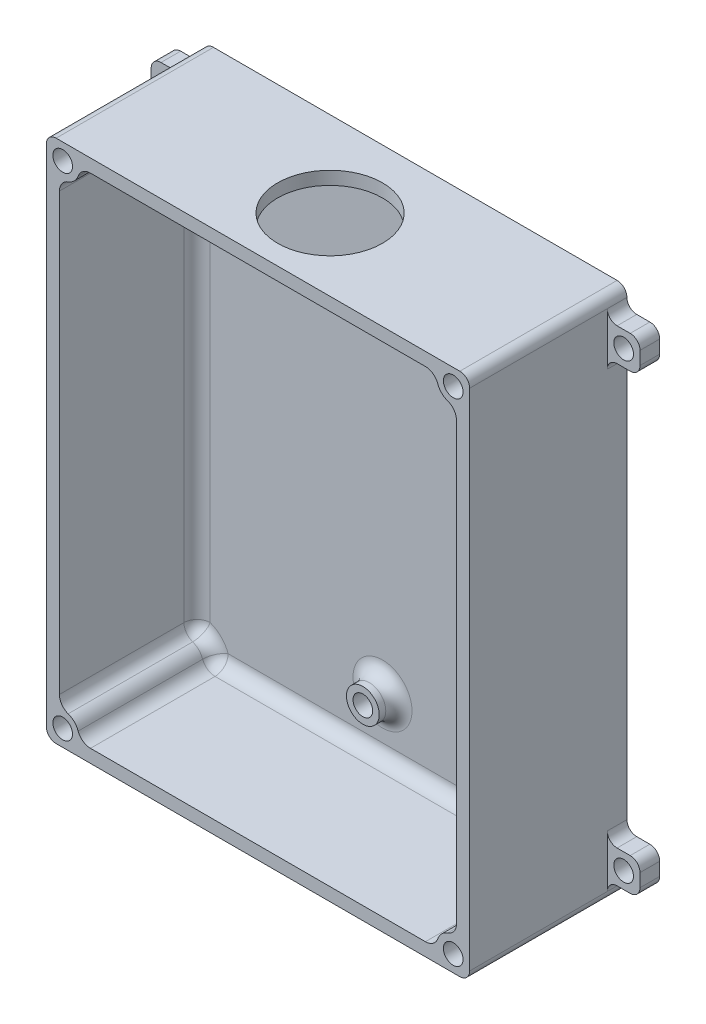
from build123d import *

# Parameters (mm, degrees)
SKETCH1_R          = 2.499999999999999
SKETCH1_W          = 60.58456356151953
SKETCH1_H          = 76
SKETCH1_R_2        = 1.5000000000000024
SKETCH1_R_3        = 1.5000000000000042
SKETCH1_R_4        = 2.500000000000004
BASE_DEPTH         = 3
WALLS_START        = 3
WALLS_DEPTH        = 21
STANDOFFS_START    = 3
SKETCH1_5_R        = 2.500000000000004
SKETCH1_5_R_2      = 1.5000000000000024
STANDOFFS_DEPTH    = 3
EXTERNAL_FILLET_R  = 1.5
INTERNAL_FILLET_R  = 2
SKETCH3_R          = 8.000000000000002
CUT_EXTRUDE1_DEPTH = 2


with BuildPart() as part:
    # Sketch1 → BASE (new body)
    # profile 1 of 53: a face of its own
    with BuildSketch(Plane.XY):
        with BuildLine():
            Line((-32.292281780759765, 39.999999999999986), (-32.292281780759765, 37.499999965069506))
            ThreePointArc((-32.292281780759765, 37.499999965069506), (-31.560048746075857, 39.267766940616646), (-29.79228178075956, 39.99999999999999))
            Line((-29.79228178075956, 39.99999999999999), (-32.292281780759765, 39.99999999999999))
        make_face()
    # profile 2 of 53: a face of its own
    with BuildSketch(Plane.XY):
        with BuildLine():
            ThreePointArc((-32.292281780759765, 37.499999965069506), (-31.728773442817484, 35.91886115638728), (-30.292281780759765, 35.050510257216814))
            Line((-30.292281780759765, 35.050510257216814), (-30.292281780759765, 36.085786437626865))
            ThreePointArc((-30.292281780759716, 36.08578643762688), (-30.85294195253962, 38.56066017177979), (-28.37806821838668, 38.000000000000014))
            Line((-28.378068218386687, 37.99999999999999), (-27.342792037976604, 37.99999999999999))
            ThreePointArc((-27.342792037976597, 38.00000000000002), (-28.21114295067551, 39.436491673103646), (-29.79228178075956, 39.99999999999999))
            ThreePointArc((-29.79228178075956, 39.99999999999999), (-31.560048746075857, 39.267766940616646), (-32.292281780759765, 37.499999965069506))
        make_face()
    # profile 3 of 53: a face of its own
    with BuildSketch(Plane.XY):
        with BuildLine():
            Line((-30.292281780759765, 36.085786437626865), (-30.292281780759765, 35.050510257216814))
            ThreePointArc((-30.292281780759765, 35.050510257216814), (-28.21114295067558, 35.56350832689628), (-27.29228178075977, 37.49999999999999))
            ThreePointArc((-27.29228178075977, 37.49999999999999), (-27.30494139824696, 37.751272405013026), (-27.342792037976597, 38.00000000000002))
            Line((-27.342792037976604, 37.99999999999999), (-28.378068218386687, 37.99999999999999))
            ThreePointArc((-28.37806821838668, 38.000000000000014), (-28.31388394127954, 37.75365296808865), (-28.29228178075977, 37.49999999999999))
            ThreePointArc((-28.29228178075977, 37.49999999999999), (-28.926256376975306, 36.27525512860842), (-30.292281780759716, 36.08578643762688))
        make_face()
    # profile 4 of 53: a face of its own
    with BuildSketch(Plane.XY):
        with BuildLine():
            Line((29.79228178075983, 40.00000000000002), (-29.79228178075956, 39.99999999999999))
            ThreePointArc((-29.79228178075956, 39.99999999999999), (-28.21114295067551, 39.436491673103646), (-27.342792037976597, 38.00000000000002))
            Line((-27.342792037976604, 37.99999999999999), (27.342792037976594, 37.99999999999999))
            ThreePointArc((27.342792037976594, 38.000000000000014), (28.211142950675608, 39.43649167310373), (29.79228178075983, 40))
        make_face()
    # profile 5 of 53: a face of its own
    with BuildSketch(Plane.XY):
        with BuildLine():
            Line((-32.292281780759765, -37.00000000000002), (-32.292281780759765, -37.49999999999999))
            ThreePointArc((-32.292281780759765, -37.49999999999999), (-31.728773453863475, -35.9188611699158), (-30.292281780759765, -35.050510257216814))
            Line((-30.292281780759765, -35.050510257216814), (-30.292281780759765, 35.050510257216814))
            ThreePointArc((-30.292281780759765, 35.050510257216814), (-31.728773442817484, 35.91886115638728), (-32.292281780759765, 37.499999965069506))
            Line((-32.292281780759765, 37.499999965069506), (-32.292281780759765, 37.000000000000014))
            Line((-32.292281780759765, 37.000000000000014), (-32.292281780759765, 32.000000000000014))
            Line((-32.292281780759765, 32.000000000000014), (-32.292281780759765, -32.000000000000014))
            Line((-32.292281780759765, -32.000000000000014), (-32.292281780759765, -37.00000000000002))
        make_face()
    # profile 6 of 53: a face of its own
    with BuildSketch(Plane.XY):
        with BuildLine():
            ThreePointArc((-32.292281780759765, 37.499999965069506), (-31.728773442817484, 35.91886115638728), (-30.292281780759765, 35.050510257216814))
            Line((-30.292281780759765, 35.050510257216814), (-30.292281780759765, 36.085786437626865))
            ThreePointArc((-30.292281780759716, 36.08578643762688), (-30.85294195253962, 38.56066017177979), (-28.37806821838668, 38.000000000000014))
            Line((-28.378068218386687, 37.99999999999999), (-27.342792037976604, 37.99999999999999))
            ThreePointArc((-27.342792037976597, 38.00000000000002), (-28.21114295067551, 39.436491673103646), (-29.79228178075956, 39.99999999999999))
            ThreePointArc((-29.79228178075956, 39.99999999999999), (-31.560048746075857, 39.267766940616646), (-32.292281780759765, 37.499999965069506))
        make_face()
    # profile 7 of 53: a face of its own
    with BuildSketch(Plane.XY):
        with BuildLine():
            Line((-30.292281780759765, 36.085786437626865), (-30.292281780759765, 35.050510257216814))
            ThreePointArc((-30.292281780759765, 35.050510257216814), (-28.21114295067558, 35.56350832689628), (-27.29228178075977, 37.49999999999999))
            ThreePointArc((-27.29228178075977, 37.49999999999999), (-27.30494139824696, 37.751272405013026), (-27.342792037976597, 38.00000000000002))
            Line((-27.342792037976604, 37.99999999999999), (-28.378068218386687, 37.99999999999999))
            ThreePointArc((-28.37806821838668, 38.000000000000014), (-28.31388394127954, 37.75365296808865), (-28.29228178075977, 37.49999999999999))
            ThreePointArc((-28.29228178075977, 37.49999999999999), (-28.926256376975306, 36.27525512860842), (-30.292281780759716, 36.08578643762688))
        make_face()
    # profile 8 of 53: a face of its own
    with BuildSketch(Plane.XY):
        with BuildLine():
            ThreePointArc((-32.292281780759765, -37.49999999999999), (-31.560048733726116, -39.26776695296638), (-29.79228178075971, -39.99999999999999))
            ThreePointArc((-29.79228178075971, -39.99999999999999), (-28.211142950675576, -39.436491673103696), (-27.3427920379766, -38.00000000000004))
            Line((-27.342792037976608, -38.000000000000014), (-28.37806821838667, -38.000000000000014))
            ThreePointArc((-28.378068218386662, -38.000000000000036), (-30.85294195253959, -38.56066017177981), (-30.29228178075972, -36.0857864376269))
            Line((-30.292281780759765, -36.085786437626886), (-30.292281780759765, -35.050510257216814))
            ThreePointArc((-30.292281780759765, -35.050510257216814), (-31.728773453863475, -35.9188611699158), (-32.292281780759765, -37.49999999999999))
        make_face()
    # profile 9 of 53: a face of its own
    with BuildSketch(Plane.XY):
        with BuildLine():
            Line((-28.37806821838667, -38.000000000000014), (-27.342792037976608, -38.000000000000014))
            ThreePointArc((-27.3427920379766, -38.00000000000004), (-27.304941398246964, -37.75127240501304), (-27.29228178075977, -37.49999999999999))
            ThreePointArc((-27.29228178075977, -37.49999999999999), (-28.21114295067558, -35.56350832689628), (-30.292281780759765, -35.050510257216814))
            Line((-30.292281780759765, -35.050510257216814), (-30.292281780759765, -36.085786437626886))
            ThreePointArc((-30.29228178075972, -36.0857864376269), (-28.926256376975296, -36.27525512860843), (-28.292281780759748, -37.50000000000001))
            ThreePointArc((-28.292281780759748, -37.50000000000001), (-28.313883941279517, -37.753652968088666), (-28.378068218386662, -38.000000000000036))
        make_face()
    # profile 10 of 53: a face of its own
    with BuildSketch(Plane.XY):
        with BuildLine():
            Line((-32.292281780759765, -37.49999999999999), (-32.292281780759765, -40.000000000000014))
            Line((-32.292281780759765, -40.000000000000014), (-29.79228178075971, -40.000000000000014))
            ThreePointArc((-29.79228178075971, -39.99999999999999), (-31.560048733726116, -39.26776695296638), (-32.292281780759765, -37.49999999999999))
        make_face()
    # profile 11 of 53: a face of its own
    with BuildSketch(Plane.XY):
        with BuildLine():
            ThreePointArc((-32.292281780759765, -37.49999999999999), (-31.560048733726116, -39.26776695296638), (-29.79228178075971, -39.99999999999999))
            ThreePointArc((-29.79228178075971, -39.99999999999999), (-28.211142950675576, -39.436491673103696), (-27.3427920379766, -38.00000000000004))
            Line((-27.342792037976608, -38.000000000000014), (-28.37806821838667, -38.000000000000014))
            ThreePointArc((-28.378068218386662, -38.000000000000036), (-30.85294195253959, -38.56066017177981), (-30.29228178075972, -36.0857864376269))
            Line((-30.292281780759765, -36.085786437626886), (-30.292281780759765, -35.050510257216814))
            ThreePointArc((-30.292281780759765, -35.050510257216814), (-31.728773453863475, -35.9188611699158), (-32.292281780759765, -37.49999999999999))
        make_face()
    # profile 12 of 53: a face of its own
    with BuildSketch(Plane.XY):
        with BuildLine():
            Line((-28.37806821838667, -38.000000000000014), (-27.342792037976608, -38.000000000000014))
            ThreePointArc((-27.3427920379766, -38.00000000000004), (-27.304941398246964, -37.75127240501304), (-27.29228178075977, -37.49999999999999))
            ThreePointArc((-27.29228178075977, -37.49999999999999), (-28.21114295067558, -35.56350832689628), (-30.292281780759765, -35.050510257216814))
            Line((-30.292281780759765, -35.050510257216814), (-30.292281780759765, -36.085786437626886))
            ThreePointArc((-30.29228178075972, -36.0857864376269), (-28.926256376975296, -36.27525512860843), (-28.292281780759748, -37.50000000000001))
            ThreePointArc((-28.292281780759748, -37.50000000000001), (-28.313883941279517, -37.753652968088666), (-28.378068218386662, -38.000000000000036))
        make_face()
    # profile 13 of 53: a face of its own
    with BuildSketch(Plane.XY):
        with BuildLine():
            ThreePointArc((-27.3427920379766, -38.00000000000004), (-28.211142950675576, -39.436491673103696), (-29.79228178075971, -39.99999999999999))
            Line((-29.79228178075971, -40.000000000000014), (29.792281775663405, -39.99999999999997))
            ThreePointArc((29.792281775663405, -40), (28.21114294870178, -39.43649167149211), (27.3427920379766, -38.000000000000036))
            Line((27.342792037976608, -38.000000000000014), (-27.342792037976608, -38.000000000000014))
        make_face()
    # profile 14 of 53: a face of its own
    with BuildSketch(Plane.XY):
        with BuildLine():
            ThreePointArc((27.3427920379766, -38.000000000000036), (28.21114294870178, -39.43649167149211), (29.792281775663405, -40))
            ThreePointArc((29.792281775663405, -40), (31.5600487319243, -39.267766954768206), (32.292281780759765, -37.5))
            ThreePointArc((32.292281780759765, -37.5), (31.728773453863468, -35.9188611699158), (30.292281780759744, -35.050510257216814))
            Line((30.292281780759765, -35.050510257216814), (30.292281780759765, -36.085786437626886))
            ThreePointArc((30.292281780759733, -36.08578643762689), (31.017026652151344, -36.633974596215545), (31.292281780759765, -37.5))
            ThreePointArc((31.292281780759765, -37.5), (30.04593474884841, -38.97839783948023), (28.378068218386677, -38))
            Line((28.378068218386673, -38.000000000000014), (27.342792037976608, -38.000000000000014))
        make_face()
    # profile 15 of 53: a face of its own
    with BuildSketch(Plane.XY):
        with BuildLine():
            ThreePointArc((30.292281780759744, -35.050510257216814), (28.02451482779338, -35.73223304703365), (27.3427920379766, -38.000000000000036))
            Line((27.342792037976608, -38.000000000000014), (28.378068218386673, -38.000000000000014))
            ThreePointArc((28.378068218386677, -38), (28.731621608979935, -36.43933982822019), (30.292281780759733, -36.08578643762689))
            Line((30.292281780759765, -36.085786437626886), (30.292281780759765, -35.050510257216814))
        make_face()
    # profile 16 of 53: a face of its own
    with BuildSketch(Plane.XY):
        with BuildLine():
            ThreePointArc((32.292281780759765, -37.5), (31.5600487319243, -39.267766954768206), (29.792281775663405, -40))
            Line((29.792281775663405, -39.99999999999997), (32.292281780759765, -39.99999999999997))
            Line((32.292281780759765, -39.99999999999997), (32.292281780759765, -37.5))
        make_face()
    # profile 17 of 53: a face of its own
    with BuildSketch(Plane.XY):
        with BuildLine():
            ThreePointArc((30.292281780759744, -35.050510257216814), (31.728773453863468, -35.9188611699158), (32.292281780759765, -37.5))
            Line((32.292281780759765, -37.5), (32.292281780759765, -36.99999999999996))
            Line((32.292281780759765, -36.99999999999996), (32.292281780759765, -32.00000000000001))
            Line((32.292281780759765, -32.00000000000001), (32.292281780759765, 32))
            Line((32.292281780759765, 32), (32.292281780759765, 36.99999999999996))
            Line((32.292281780759765, 36.99999999999996), (32.292281780759765, 37.5))
            ThreePointArc((32.292281780759765, 37.5), (31.728773453863468, 35.9188611699158), (30.292281780759748, 35.05051025721682))
            Line((30.292281780759765, 35.050510257216814), (30.292281780759765, -35.050510257216814))
        make_face()
    # profile 18 of 53: a face of its own
    with BuildSketch(Plane.XY):
        with BuildLine():
            ThreePointArc((27.3427920379766, -38.000000000000036), (28.21114294870178, -39.43649167149211), (29.792281775663405, -40))
            ThreePointArc((29.792281775663405, -40), (31.5600487319243, -39.267766954768206), (32.292281780759765, -37.5))
            ThreePointArc((32.292281780759765, -37.5), (31.728773453863468, -35.9188611699158), (30.292281780759744, -35.050510257216814))
            Line((30.292281780759765, -35.050510257216814), (30.292281780759765, -36.085786437626886))
            ThreePointArc((30.292281780759733, -36.08578643762689), (31.017026652151344, -36.633974596215545), (31.292281780759765, -37.5))
            ThreePointArc((31.292281780759765, -37.5), (30.04593474884841, -38.97839783948023), (28.378068218386677, -38))
            Line((28.378068218386673, -38.000000000000014), (27.342792037976608, -38.000000000000014))
        make_face()
    # profile 19 of 53: a face of its own
    with BuildSketch(Plane.XY):
        with BuildLine():
            ThreePointArc((30.292281780759744, -35.050510257216814), (28.02451482779338, -35.73223304703365), (27.3427920379766, -38.000000000000036))
            Line((27.342792037976608, -38.000000000000014), (28.378068218386673, -38.000000000000014))
            ThreePointArc((28.378068218386677, -38), (28.731621608979935, -36.43933982822019), (30.292281780759733, -36.08578643762689))
            Line((30.292281780759765, -36.085786437626886), (30.292281780759765, -35.050510257216814))
        make_face()
    # profile 20 of 53: a face of its own
    with BuildSketch(Plane.XY):
        with Locations((-29.79228178075977, -37.49999999999999)):
            Circle(SKETCH1_R)
    # profile 21 of 53: a face of its own
    with BuildSketch(Plane.XY):
        with Locations((29.79228178075977, -37.5)):
            Circle(SKETCH1_R)
    # profile 22 of 53: a face of its own
    with BuildSketch(Plane.XY):
        with Locations((29.79228178075977, 37.5)):
            Circle(SKETCH1_R)
    # profile 23 of 53: a face of its own
    with BuildSketch(Plane.XY):
        with Locations((-29.79228178075977, 37.49999999999999)):
            Circle(SKETCH1_R)
    # profile 24 of 53: a face of its own
    with BuildSketch(Plane.XY):
        Rectangle(SKETCH1_W, SKETCH1_H)
        with Locations((-2.000000000000231, -29.543000000000013)):
            Circle(SKETCH1_R_2, mode=Mode.SUBTRACT)
        with Locations((-2.000000000000231, 23.54299999999998)):
            Circle(SKETCH1_R_2, mode=Mode.SUBTRACT)
    # profile 25 of 53: a face of its own
    with BuildSketch(Plane.XY):
        with BuildLine():
            ThreePointArc((29.79228178075983, 40), (31.56004873372616, 39.26776695296635), (32.292281780759765, 37.5))
            Line((32.292281780759765, 37.5), (32.292281780759765, 40.00000000000003))
            Line((32.292281780759765, 40.00000000000002), (29.79228178075983, 40.00000000000002))
        make_face()
    # profile 26 of 53: a face of its own
    with BuildSketch(Plane.XY):
        with BuildLine():
            ThreePointArc((27.342792037976594, 38.000000000000014), (28.02451482779339, 35.732233047033645), (30.292281780759748, 35.05051025721682))
            Line((30.292281780759765, 35.050510257216814), (30.292281780759765, 36.08578643762688))
            ThreePointArc((30.29228178075973, 36.08578643762689), (28.731621608979946, 36.439339828220184), (28.378068218386666, 37.99999999999997))
            Line((28.37806821838666, 37.99999999999999), (27.342792037976594, 37.99999999999999))
        make_face()
    # profile 27 of 53: a face of its own
    with BuildSketch(Plane.XY):
        with BuildLine():
            Line((30.292281780759765, 36.08578643762688), (30.292281780759765, 35.050510257216814))
            ThreePointArc((30.292281780759748, 35.05051025721682), (31.728773453863468, 35.9188611699158), (32.292281780759765, 37.5))
            ThreePointArc((32.292281780759765, 37.5), (31.56004873372616, 39.26776695296635), (29.79228178075983, 40))
            ThreePointArc((29.79228178075983, 40), (28.211142950675608, 39.43649167310373), (27.342792037976594, 38.000000000000014))
            Line((27.342792037976594, 37.99999999999999), (28.37806821838666, 37.99999999999999))
            ThreePointArc((28.378068218386666, 37.99999999999997), (30.045934748848396, 38.97839783948023), (31.292281780759765, 37.5))
            ThreePointArc((31.292281780759765, 37.5), (31.017026652151344, 36.633974596215545), (30.29228178075973, 36.08578643762689))
        make_face()
    # profile 28 of 53: a face of its own
    with BuildSketch(Plane.XY):
        with BuildLine():
            ThreePointArc((27.342792037976594, 38.000000000000014), (28.02451482779339, 35.732233047033645), (30.292281780759748, 35.05051025721682))
            Line((30.292281780759765, 35.050510257216814), (30.292281780759765, 36.08578643762688))
            ThreePointArc((30.29228178075973, 36.08578643762689), (28.731621608979946, 36.439339828220184), (28.378068218386666, 37.99999999999997))
            Line((28.37806821838666, 37.99999999999999), (27.342792037976594, 37.99999999999999))
        make_face()
    # profile 29 of 53: a face of its own
    with BuildSketch(Plane.XY):
        with BuildLine():
            Line((30.292281780759765, 36.08578643762688), (30.292281780759765, 35.050510257216814))
            ThreePointArc((30.292281780759748, 35.05051025721682), (31.728773453863468, 35.9188611699158), (32.292281780759765, 37.5))
            ThreePointArc((32.292281780759765, 37.5), (31.56004873372616, 39.26776695296635), (29.79228178075983, 40))
            ThreePointArc((29.79228178075983, 40), (28.211142950675608, 39.43649167310373), (27.342792037976594, 38.000000000000014))
            Line((27.342792037976594, 37.99999999999999), (28.37806821838666, 37.99999999999999))
            ThreePointArc((28.378068218386666, 37.99999999999997), (30.045934748848396, 38.97839783948023), (31.292281780759765, 37.5))
            ThreePointArc((31.292281780759765, 37.5), (31.017026652151344, 36.633974596215545), (30.29228178075973, 36.08578643762689))
        make_face()
    # profile 30 of 53: a face of its own
    with BuildSketch(Plane.XY):
        Polygon((32.292281780759765, 36.99999999999996), (32.292281780759765, 32), (37.29228178075976, 31.99999999999998), (37.29228178075976, 36.99999999999998), align=None)
        with Locations((34.79228178075976, 34.49999999999998)):
            Circle(SKETCH1_R_3, mode=Mode.SUBTRACT)
    # profile 31 of 53: a face of its own
    with BuildSketch(Plane.XY):
        Polygon((-37.29228178075977, -37.00000000000002), (-32.29228178075977, -37.00000000000002), (-32.292281780759765, -32.000000000000014), (-37.29228178075977, -32.000000000000014), align=None)
        with Locations((-34.79228178075977, -34.500000000000014)):
            Circle(SKETCH1_R_3, mode=Mode.SUBTRACT)
    # profile 32 of 53: a face of its own
    with BuildSketch(Plane.XY):
        with BuildLine():
            ThreePointArc((-28.37806821838668, 38.000000000000014), (-30.85294195253962, 38.56066017177979), (-30.292281780759716, 36.08578643762688))
            Line((-30.292281780759765, 36.085786437626865), (-30.292281780759765, 37.999999999999986))
            Line((-30.292281780759765, 37.99999999999999), (-28.378068218386687, 37.99999999999999))
        make_face()
    # profile 33 of 53: a face of its own
    with BuildSketch(Plane.XY):
        with BuildLine():
            Line((-30.292281780759765, 37.999999999999986), (-30.292281780759765, 36.085786437626865))
            ThreePointArc((-30.292281780759716, 36.08578643762688), (-28.926256376975306, 36.27525512860842), (-28.29228178075977, 37.49999999999999))
            ThreePointArc((-28.29228178075977, 37.49999999999999), (-28.31388394127954, 37.75365296808865), (-28.37806821838668, 38.000000000000014))
            Line((-28.378068218386687, 37.99999999999999), (-30.292281780759765, 37.99999999999999))
        make_face()
    # profile 34 of 53: a face of its own
    with BuildSketch(Plane.XY):
        with BuildLine():
            ThreePointArc((28.378068218386666, 37.99999999999997), (28.731621608979946, 36.439339828220184), (30.29228178075973, 36.08578643762689))
            Line((30.292281780759765, 36.08578643762688), (30.292281780759765, 37.999999999999986))
            Line((30.292281780759765, 37.99999999999999), (28.37806821838666, 37.99999999999999))
        make_face()
    # profile 35 of 53: a face of its own
    with BuildSketch(Plane.XY):
        with BuildLine():
            Line((30.292281780759765, 37.999999999999986), (30.292281780759765, 36.08578643762688))
            ThreePointArc((30.29228178075973, 36.08578643762689), (31.017026652151344, 36.633974596215545), (31.292281780759765, 37.5))
            ThreePointArc((31.292281780759765, 37.5), (30.045934748848396, 38.97839783948023), (28.378068218386666, 37.99999999999997))
            Line((28.37806821838666, 37.99999999999999), (30.292281780759765, 37.99999999999999))
        make_face()
    # profile 36 of 53: a face of its own
    with BuildSketch(Plane.XY):
        with BuildLine():
            ThreePointArc((30.292281780759733, -36.08578643762689), (28.731621608979935, -36.43933982822019), (28.378068218386677, -38))
            Line((28.378068218386673, -38.000000000000014), (30.292281780759765, -38.000000000000014))
            Line((30.292281780759765, -38.000000000000014), (30.292281780759765, -36.085786437626886))
        make_face()
    # profile 37 of 53: a face of its own
    with BuildSketch(Plane.XY):
        with BuildLine():
            Line((30.292281780759765, -38.000000000000014), (28.378068218386673, -38.000000000000014))
            ThreePointArc((28.378068218386677, -38), (30.04593474884841, -38.97839783948023), (31.292281780759765, -37.5))
            ThreePointArc((31.292281780759765, -37.5), (31.017026652151344, -36.633974596215545), (30.292281780759733, -36.08578643762689))
            Line((30.292281780759765, -36.085786437626886), (30.292281780759765, -38.000000000000014))
        make_face()
    # profile 38 of 53: a face of its own
    with BuildSketch(Plane.XY):
        with BuildLine():
            ThreePointArc((30.292281780759733, -36.08578643762689), (28.731621608979935, -36.43933982822019), (28.378068218386677, -38))
            Line((28.378068218386673, -38.000000000000014), (30.292281780759765, -38.000000000000014))
            Line((30.292281780759765, -38.000000000000014), (30.292281780759765, -36.085786437626886))
        make_face()
    # profile 39 of 53: a face of its own
    with BuildSketch(Plane.XY):
        with BuildLine():
            Line((30.292281780759765, -38.000000000000014), (28.378068218386673, -38.000000000000014))
            ThreePointArc((28.378068218386677, -38), (30.04593474884841, -38.97839783948023), (31.292281780759765, -37.5))
            ThreePointArc((31.292281780759765, -37.5), (31.017026652151344, -36.633974596215545), (30.292281780759733, -36.08578643762689))
            Line((30.292281780759765, -36.085786437626886), (30.292281780759765, -38.000000000000014))
        make_face()
    # profile 40 of 53: a face of its own
    with BuildSketch(Plane.XY):
        with BuildLine():
            ThreePointArc((28.378068218386666, 37.99999999999997), (28.731621608979946, 36.439339828220184), (30.29228178075973, 36.08578643762689))
            Line((30.292281780759765, 36.08578643762688), (30.292281780759765, 37.999999999999986))
            Line((30.292281780759765, 37.99999999999999), (28.37806821838666, 37.99999999999999))
        make_face()
    # profile 41 of 53: a face of its own
    with BuildSketch(Plane.XY):
        with BuildLine():
            Line((30.292281780759765, 37.999999999999986), (30.292281780759765, 36.08578643762688))
            ThreePointArc((30.29228178075973, 36.08578643762689), (31.017026652151344, 36.633974596215545), (31.292281780759765, 37.5))
            ThreePointArc((31.292281780759765, 37.5), (30.045934748848396, 38.97839783948023), (28.378068218386666, 37.99999999999997))
            Line((28.37806821838666, 37.99999999999999), (30.292281780759765, 37.99999999999999))
        make_face()
    # profile 42 of 53: a face of its own
    with BuildSketch(Plane.XY):
        with BuildLine():
            ThreePointArc((-28.37806821838668, 38.000000000000014), (-30.85294195253962, 38.56066017177979), (-30.292281780759716, 36.08578643762688))
            Line((-30.292281780759765, 36.085786437626865), (-30.292281780759765, 37.999999999999986))
            Line((-30.292281780759765, 37.99999999999999), (-28.378068218386687, 37.99999999999999))
        make_face()
    # profile 43 of 53: a face of its own
    with BuildSketch(Plane.XY):
        with BuildLine():
            Line((-30.292281780759765, 37.999999999999986), (-30.292281780759765, 36.085786437626865))
            ThreePointArc((-30.292281780759716, 36.08578643762688), (-28.926256376975306, 36.27525512860842), (-28.29228178075977, 37.49999999999999))
            ThreePointArc((-28.29228178075977, 37.49999999999999), (-28.31388394127954, 37.75365296808865), (-28.37806821838668, 38.000000000000014))
            Line((-28.378068218386687, 37.99999999999999), (-30.292281780759765, 37.99999999999999))
        make_face()
    # profile 44 of 53: a face of its own
    with BuildSketch(Plane.XY):
        with BuildLine():
            ThreePointArc((-30.29228178075972, -36.0857864376269), (-30.85294195253959, -38.56066017177981), (-28.378068218386662, -38.000000000000036))
            Line((-28.37806821838667, -38.000000000000014), (-30.292281780759765, -38.000000000000014))
            Line((-30.292281780759765, -38.000000000000014), (-30.292281780759765, -36.085786437626886))
        make_face()
    # profile 45 of 53: a face of its own
    with BuildSketch(Plane.XY):
        with BuildLine():
            Line((-30.292281780759765, -38.000000000000014), (-28.37806821838667, -38.000000000000014))
            ThreePointArc((-28.378068218386662, -38.000000000000036), (-28.313883941279517, -37.753652968088666), (-28.292281780759748, -37.50000000000001))
            ThreePointArc((-28.292281780759748, -37.50000000000001), (-28.926256376975296, -36.27525512860843), (-30.29228178075972, -36.0857864376269))
            Line((-30.292281780759765, -36.085786437626886), (-30.292281780759765, -38.000000000000014))
        make_face()
    # profile 46 of 53: a face of its own
    with BuildSketch(Plane.XY):
        with BuildLine():
            ThreePointArc((-30.29228178075972, -36.0857864376269), (-30.85294195253959, -38.56066017177981), (-28.378068218386662, -38.000000000000036))
            Line((-28.37806821838667, -38.000000000000014), (-30.292281780759765, -38.000000000000014))
            Line((-30.292281780759765, -38.000000000000014), (-30.292281780759765, -36.085786437626886))
        make_face()
    # profile 47 of 53: a face of its own
    with BuildSketch(Plane.XY):
        with BuildLine():
            Line((-30.292281780759765, -38.000000000000014), (-28.37806821838667, -38.000000000000014))
            ThreePointArc((-28.378068218386662, -38.000000000000036), (-28.313883941279517, -37.753652968088666), (-28.292281780759748, -37.50000000000001))
            ThreePointArc((-28.292281780759748, -37.50000000000001), (-28.926256376975296, -36.27525512860843), (-30.29228178075972, -36.0857864376269))
            Line((-30.292281780759765, -36.085786437626886), (-30.292281780759765, -38.000000000000014))
        make_face()
    # profile 48 of 53: a face of its own
    with BuildSketch(Plane.XY):
        with Locations((-2.000000000000231, 23.54299999999998)):
            Circle(SKETCH1_R_4)
        with Locations((-2.000000000000231, 23.54299999999998)):
            Circle(SKETCH1_R_2, mode=Mode.SUBTRACT)
    # profile 49 of 53: a face of its own
    with BuildSketch(Plane.XY):
        with Locations((-2.000000000000231, 23.54299999999998)):
            Circle(SKETCH1_R_2)
    # profile 50 of 53: a face of its own
    with BuildSketch(Plane.XY):
        with Locations((-2.000000000000231, -29.543000000000013)):
            Circle(SKETCH1_R_4)
        with Locations((-2.000000000000231, -29.543000000000013)):
            Circle(SKETCH1_R_2, mode=Mode.SUBTRACT)
    # profile 51 of 53: a face of its own
    with BuildSketch(Plane.XY):
        with Locations((-2.000000000000231, -29.543000000000013)):
            Circle(SKETCH1_R_2)
    # profile 52 of 53: a face of its own
    with BuildSketch(Plane.XY):
        Polygon((32.292281780759765, -32.00000000000001), (32.292281780759765, -36.99999999999996), (37.29228178075976, -36.99999999999998), (37.29228178075976, -31.99999999999998), align=None)
        with Locations((34.79228178075976, -34.49999999999998)):
            Circle(SKETCH1_R_3, mode=Mode.SUBTRACT)
    # profile 53 of 53: a face of its own
    with BuildSketch(Plane.XY):
        Polygon((-37.29228178075977, 32.000000000000014), (-32.29228178075977, 32.000000000000014), (-32.292281780759765, 37.000000000000014), (-37.29228178075977, 37.00000000000002), align=None)
        with Locations((-34.79228178075977, 34.500000000000014)):
            Circle(SKETCH1_R_3, mode=Mode.SUBTRACT)
    extrude(amount=BASE_DEPTH)

    # Sketch1<3> → WALLS (add)
    with BuildSketch(Plane.XY.offset(WALLS_START)):
        with BuildLine():
            Line((29.79228178075983, 40.00000000000002), (-29.79228178075956, 39.99999999999999))
            ThreePointArc((-29.79228178075956, 39.99999999999999), (-28.21114295067551, 39.436491673103646), (-27.342792037976597, 38.00000000000002))
            Line((-27.342792037976604, 37.99999999999999), (27.342792037976594, 37.99999999999999))
            ThreePointArc((27.342792037976594, 38.000000000000014), (28.211142950675608, 39.43649167310373), (29.79228178075983, 40))
        make_face()
        with BuildLine():
            ThreePointArc((-32.292281780759765, 37.499999965069506), (-31.728773442817484, 35.91886115638728), (-30.292281780759765, 35.050510257216814))
            Line((-30.292281780759765, 35.050510257216814), (-30.292281780759765, 36.085786437626865))
            ThreePointArc((-30.292281780759716, 36.08578643762688), (-30.85294195253962, 38.56066017177979), (-28.37806821838668, 38.000000000000014))
            Line((-28.378068218386687, 37.99999999999999), (-27.342792037976604, 37.99999999999999))
            ThreePointArc((-27.342792037976597, 38.00000000000002), (-28.21114295067551, 39.436491673103646), (-29.79228178075956, 39.99999999999999))
            ThreePointArc((-29.79228178075956, 39.99999999999999), (-31.560048746075857, 39.267766940616646), (-32.292281780759765, 37.499999965069506))
        make_face()
        with BuildLine():
            Line((-30.292281780759765, 36.085786437626865), (-30.292281780759765, 35.050510257216814))
            ThreePointArc((-30.292281780759765, 35.050510257216814), (-28.21114295067558, 35.56350832689628), (-27.29228178075977, 37.49999999999999))
            ThreePointArc((-27.29228178075977, 37.49999999999999), (-27.30494139824696, 37.751272405013026), (-27.342792037976597, 38.00000000000002))
            Line((-27.342792037976604, 37.99999999999999), (-28.378068218386687, 37.99999999999999))
            ThreePointArc((-28.37806821838668, 38.000000000000014), (-28.31388394127954, 37.75365296808865), (-28.29228178075977, 37.49999999999999))
            ThreePointArc((-28.29228178075977, 37.49999999999999), (-28.926256376975306, 36.27525512860842), (-30.292281780759716, 36.08578643762688))
        make_face()
        with BuildLine():
            Line((-32.292281780759765, 39.999999999999986), (-32.292281780759765, 37.499999965069506))
            ThreePointArc((-32.292281780759765, 37.499999965069506), (-31.560048746075857, 39.267766940616646), (-29.79228178075956, 39.99999999999999))
            Line((-29.79228178075956, 39.99999999999999), (-32.292281780759765, 39.99999999999999))
        make_face()
        with BuildLine():
            Line((-32.292281780759765, -37.00000000000002), (-32.292281780759765, -37.49999999999999))
            ThreePointArc((-32.292281780759765, -37.49999999999999), (-31.728773453863475, -35.9188611699158), (-30.292281780759765, -35.050510257216814))
            Line((-30.292281780759765, -35.050510257216814), (-30.292281780759765, 35.050510257216814))
            ThreePointArc((-30.292281780759765, 35.050510257216814), (-31.728773442817484, 35.91886115638728), (-32.292281780759765, 37.499999965069506))
            Line((-32.292281780759765, 37.499999965069506), (-32.292281780759765, 37.000000000000014))
            Line((-32.292281780759765, 37.000000000000014), (-32.292281780759765, 32.000000000000014))
            Line((-32.292281780759765, 32.000000000000014), (-32.292281780759765, -32.000000000000014))
            Line((-32.292281780759765, -32.000000000000014), (-32.292281780759765, -37.00000000000002))
        make_face()
        with BuildLine():
            ThreePointArc((-32.292281780759765, -37.49999999999999), (-31.560048733726116, -39.26776695296638), (-29.79228178075971, -39.99999999999999))
            ThreePointArc((-29.79228178075971, -39.99999999999999), (-28.211142950675576, -39.436491673103696), (-27.3427920379766, -38.00000000000004))
            Line((-27.342792037976608, -38.000000000000014), (-28.37806821838667, -38.000000000000014))
            ThreePointArc((-28.378068218386662, -38.000000000000036), (-30.85294195253959, -38.56066017177981), (-30.29228178075972, -36.0857864376269))
            Line((-30.292281780759765, -36.085786437626886), (-30.292281780759765, -35.050510257216814))
            ThreePointArc((-30.292281780759765, -35.050510257216814), (-31.728773453863475, -35.9188611699158), (-32.292281780759765, -37.49999999999999))
        make_face()
        with BuildLine():
            Line((-28.37806821838667, -38.000000000000014), (-27.342792037976608, -38.000000000000014))
            ThreePointArc((-27.3427920379766, -38.00000000000004), (-27.304941398246964, -37.75127240501304), (-27.29228178075977, -37.49999999999999))
            ThreePointArc((-27.29228178075977, -37.49999999999999), (-28.21114295067558, -35.56350832689628), (-30.292281780759765, -35.050510257216814))
            Line((-30.292281780759765, -35.050510257216814), (-30.292281780759765, -36.085786437626886))
            ThreePointArc((-30.29228178075972, -36.0857864376269), (-28.926256376975296, -36.27525512860843), (-28.292281780759748, -37.50000000000001))
            ThreePointArc((-28.292281780759748, -37.50000000000001), (-28.313883941279517, -37.753652968088666), (-28.378068218386662, -38.000000000000036))
        make_face()
        with BuildLine():
            Line((-32.292281780759765, -37.49999999999999), (-32.292281780759765, -40.000000000000014))
            Line((-32.292281780759765, -40.000000000000014), (-29.79228178075971, -40.000000000000014))
            ThreePointArc((-29.79228178075971, -39.99999999999999), (-31.560048733726116, -39.26776695296638), (-32.292281780759765, -37.49999999999999))
        make_face()
        with BuildLine():
            ThreePointArc((-27.3427920379766, -38.00000000000004), (-28.211142950675576, -39.436491673103696), (-29.79228178075971, -39.99999999999999))
            Line((-29.79228178075971, -40.000000000000014), (29.792281775663405, -39.99999999999997))
            ThreePointArc((29.792281775663405, -40), (28.21114294870178, -39.43649167149211), (27.3427920379766, -38.000000000000036))
            Line((27.342792037976608, -38.000000000000014), (-27.342792037976608, -38.000000000000014))
        make_face()
        with BuildLine():
            ThreePointArc((27.3427920379766, -38.000000000000036), (28.21114294870178, -39.43649167149211), (29.792281775663405, -40))
            ThreePointArc((29.792281775663405, -40), (31.5600487319243, -39.267766954768206), (32.292281780759765, -37.5))
            ThreePointArc((32.292281780759765, -37.5), (31.728773453863468, -35.9188611699158), (30.292281780759744, -35.050510257216814))
            Line((30.292281780759765, -35.050510257216814), (30.292281780759765, -36.085786437626886))
            ThreePointArc((30.292281780759733, -36.08578643762689), (31.017026652151344, -36.633974596215545), (31.292281780759765, -37.5))
            ThreePointArc((31.292281780759765, -37.5), (30.04593474884841, -38.97839783948023), (28.378068218386677, -38))
            Line((28.378068218386673, -38.000000000000014), (27.342792037976608, -38.000000000000014))
        make_face()
        with BuildLine():
            ThreePointArc((30.292281780759744, -35.050510257216814), (28.02451482779338, -35.73223304703365), (27.3427920379766, -38.000000000000036))
            Line((27.342792037976608, -38.000000000000014), (28.378068218386673, -38.000000000000014))
            ThreePointArc((28.378068218386677, -38), (28.731621608979935, -36.43933982822019), (30.292281780759733, -36.08578643762689))
            Line((30.292281780759765, -36.085786437626886), (30.292281780759765, -35.050510257216814))
        make_face()
        with BuildLine():
            ThreePointArc((32.292281780759765, -37.5), (31.5600487319243, -39.267766954768206), (29.792281775663405, -40))
            Line((29.792281775663405, -39.99999999999997), (32.292281780759765, -39.99999999999997))
            Line((32.292281780759765, -39.99999999999997), (32.292281780759765, -37.5))
        make_face()
        with BuildLine():
            ThreePointArc((30.292281780759744, -35.050510257216814), (31.728773453863468, -35.9188611699158), (32.292281780759765, -37.5))
            Line((32.292281780759765, -37.5), (32.292281780759765, -36.99999999999996))
            Line((32.292281780759765, -36.99999999999996), (32.292281780759765, -32.00000000000001))
            Line((32.292281780759765, -32.00000000000001), (32.292281780759765, 32))
            Line((32.292281780759765, 32), (32.292281780759765, 36.99999999999996))
            Line((32.292281780759765, 36.99999999999996), (32.292281780759765, 37.5))
            ThreePointArc((32.292281780759765, 37.5), (31.728773453863468, 35.9188611699158), (30.292281780759748, 35.05051025721682))
            Line((30.292281780759765, 35.050510257216814), (30.292281780759765, -35.050510257216814))
        make_face()
        with BuildLine():
            ThreePointArc((27.342792037976594, 38.000000000000014), (28.02451482779339, 35.732233047033645), (30.292281780759748, 35.05051025721682))
            Line((30.292281780759765, 35.050510257216814), (30.292281780759765, 36.08578643762688))
            ThreePointArc((30.29228178075973, 36.08578643762689), (28.731621608979946, 36.439339828220184), (28.378068218386666, 37.99999999999997))
            Line((28.37806821838666, 37.99999999999999), (27.342792037976594, 37.99999999999999))
        make_face()
        with BuildLine():
            Line((30.292281780759765, 36.08578643762688), (30.292281780759765, 35.050510257216814))
            ThreePointArc((30.292281780759748, 35.05051025721682), (31.728773453863468, 35.9188611699158), (32.292281780759765, 37.5))
            ThreePointArc((32.292281780759765, 37.5), (31.56004873372616, 39.26776695296635), (29.79228178075983, 40))
            ThreePointArc((29.79228178075983, 40), (28.211142950675608, 39.43649167310373), (27.342792037976594, 38.000000000000014))
            Line((27.342792037976594, 37.99999999999999), (28.37806821838666, 37.99999999999999))
            ThreePointArc((28.378068218386666, 37.99999999999997), (30.045934748848396, 38.97839783948023), (31.292281780759765, 37.5))
            ThreePointArc((31.292281780759765, 37.5), (31.017026652151344, 36.633974596215545), (30.29228178075973, 36.08578643762689))
        make_face()
        with BuildLine():
            ThreePointArc((29.79228178075983, 40), (31.56004873372616, 39.26776695296635), (32.292281780759765, 37.5))
            Line((32.292281780759765, 37.5), (32.292281780759765, 40.00000000000003))
            Line((32.292281780759765, 40.00000000000002), (29.79228178075983, 40.00000000000002))
        make_face()
    extrude(amount=WALLS_DEPTH)

    # Sketch1<5> → STANDOFFs (add)
    # profile 1 of 2: a face of its own
    with BuildSketch(Plane.XY.offset(STANDOFFS_START)):
        with Locations((-2.000000000000231, -29.543000000000013)):
            Circle(SKETCH1_5_R)
        with Locations((-2.000000000000231, -29.543000000000013)):
            Circle(SKETCH1_5_R_2, mode=Mode.SUBTRACT)
    # profile 2 of 2: a face of its own
    with BuildSketch(Plane.XY.offset(STANDOFFS_START)):
        with Locations((-2.000000000000231, 23.54299999999998)):
            Circle(SKETCH1_5_R)
        with Locations((-2.000000000000231, 23.54299999999998)):
            Circle(SKETCH1_5_R_2, mode=Mode.SUBTRACT)
    extrude(amount=STANDOFFS_DEPTH)

    # External Fillet
    external_fillet_edges = [part.edges().sort_by_distance(p)[0] for p in [
        (-32.292281780759765, -37.00000000000002, 1.5),
        (-37.29228178075977, -37.00000000000002, 1.5),
        (-37.29228178075977, -32.000000000000014, 1.5),
        (-32.292281780759765, -32.000000000000014, 1.5),
        (-32.292281780759765, 32.000000000000014, 1.5),
        (-37.29228178075977, 32.000000000000014, 1.5),
        (-37.29228178075977, 37.00000000000002, 1.5),
        (-32.292281780759765, 37.000000000000014, 1.5),
        (-32.292281780759765, 39.999999999999986, 12),
        (32.292281780759765, 40.00000000000003, 12),
        (32.29228178075976, 36.99999999999996, 1.5),
        (37.29228178075976, 36.99999999999998, 1.5),
        (37.29228178075976, 31.99999999999998, 1.5),
        (32.29228178075976, 32, 1.5),
        (32.29228178075976, -32.00000000000001, 1.5),
        (37.29228178075976, -31.99999999999998, 1.5),
        (37.29228178075976, -36.99999999999998, 1.5),
        (32.29228178075976, -36.99999999999996, 1.5),
        (32.292281780759765, -39.99999999999997, 12),
        (-32.292281780759765, -40.000000000000014, 12),
    ]]
    fillet(external_fillet_edges, radius=EXTERNAL_FILLET_R - 0.0001)  # a hair under: the kernel refuses the full size

    # Internal Fillet
    internal_fillet_edges = [part.edges().sort_by_distance(p)[0] for p in [
        (0, 38, 3),
        (-30.292281780759755, 0, 3),
        (28.02451482779338, -35.73223304703365, 3),
        (30.292281780759755, -35.050510257216814, 13.5),
        (30.292281780759765, 0, 3),
        (30.292281780759758, 35.050510257216814, 13.5),
        (28.02451482779339, 35.732233047033645, 3),
        (27.342792037976594, 38, 13.5),
        (-27.3427920379766, 38.00000000000001, 13.5),
        (-28.024514827793393, 35.73223304703363, 3),
        (-30.292281780759765, 35.050510257216814, 13.5),
        (-30.292281780759765, -35.050510257216814, 13.5),
        (-28.02451482779338, -35.73223304703336, 3),
        (-27.342792037976608, -38.00000000000003, 13.5),
        (-3.55e-15, -38.00000000000002, 3),
        (27.3427920379766, -38.00000000000003, 13.5),
        (-4.5000000000002345, -29.543000000000013, 3),
        (-4.5000000000002345, 23.54299999999998, 3),
    ]]
    fillet(internal_fillet_edges, radius=INTERNAL_FILLET_R)

    # Sketch3 → Cut-Extrude1 (cut)
    with BuildSketch(Plane(origin=(7.707718219240211, 40, 0), x_dir=(0, 0, 1), z_dir=(4.3e-16, -1, 0))):
        with Locations(Location((13.000000000000002, 7.707718219240232, 0), (0, 0, 180))):
            Circle(SKETCH3_R)
    extrude(amount=CUT_EXTRUDE1_DEPTH, mode=Mode.SUBTRACT)


solid = part.part
